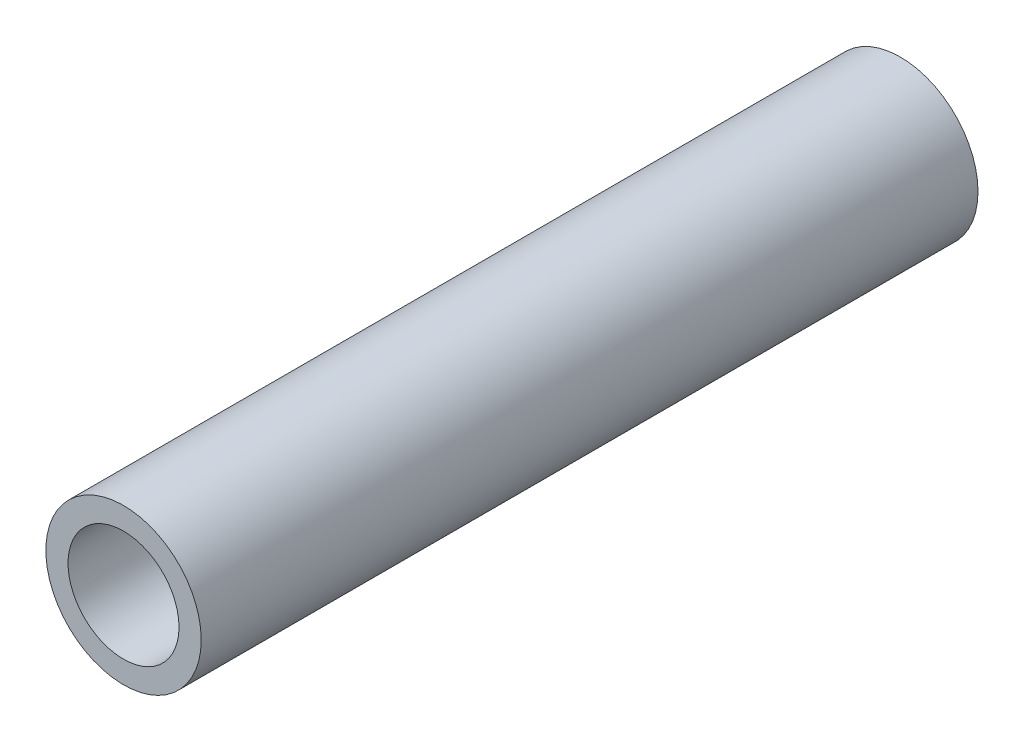
from build123d import *

# Parameters (mm, degrees)
SCHIZZO1_R                   = 70
SCHIZZO1_R_2                 = 50
ESTRUSIONE_ESTRUSIONE1_DEPTH = 700


with BuildPart() as part:
    # Schizzo1 → Estrusione-Estrusione1 (new body)
    with BuildSketch(Plane.XY):
        Circle(SCHIZZO1_R)
        Circle(SCHIZZO1_R_2, mode=Mode.SUBTRACT)
    extrude(amount=ESTRUSIONE_ESTRUSIONE1_DEPTH)


solid = part.part
